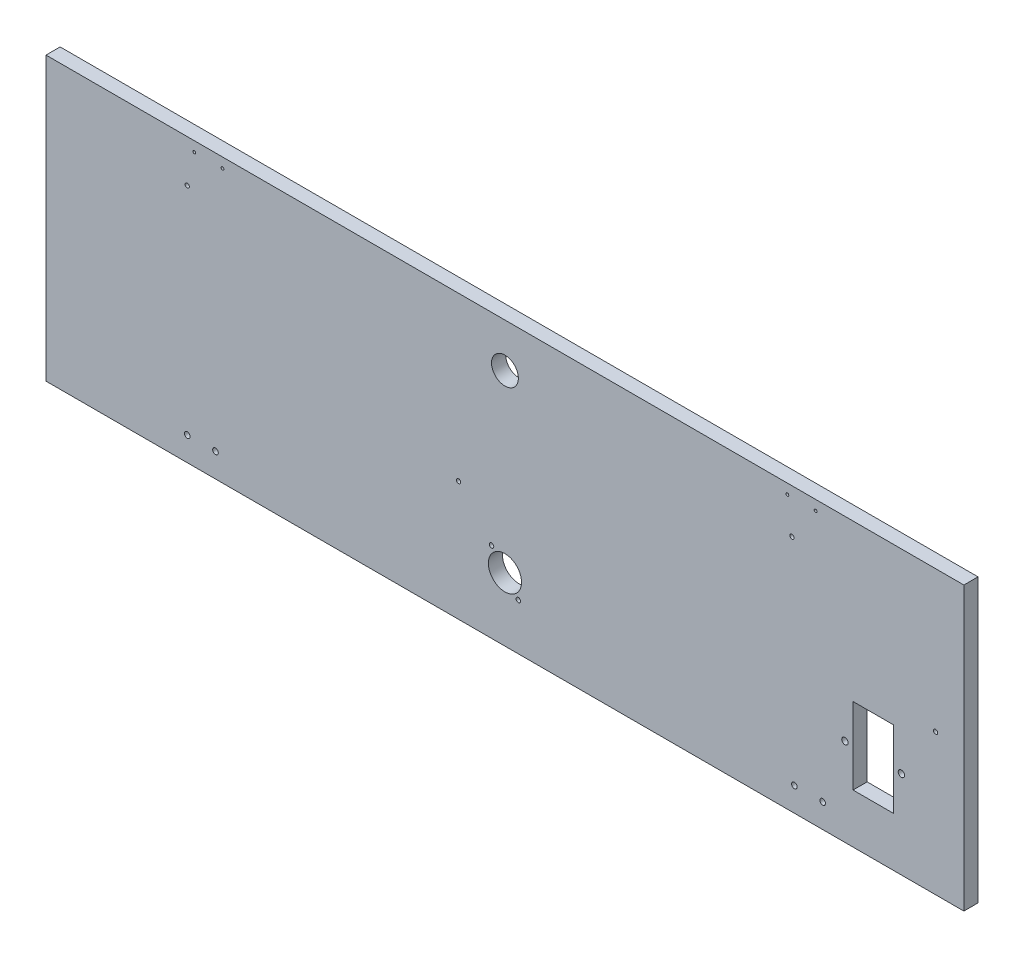
from build123d import *

# Parameters (mm, degrees)
ESQUISSE1_W             = 650
ESQUISSE1_H             = 200
BOSS_EXTRU_1_DEPTH      = 10
ESQUISSE2_R             = 2
ENL_V_MAT_EXTRU_1_DEPTH = 10
ESQUISSE3_R             = 1.6
ESQUISSE3_R_2           = 11.75
ESQUISSE3_W             = 28.5
ESQUISSE3_H             = 54.3
ESQUISSE3_R_3           = 2.25
ENL_V_MAT_EXTRU_2_DEPTH = 10
ESQUISSE4_R             = 9.5
ENL_V_MAT_EXTRU_3_DEPTH = 10
ESQUISSE5_R             = 1
ENL_V_MAT_EXTRU_4_DEPTH = 2
ESQUISSE6_R             = 1.5
ESQUISSE6_R_2           = 1
ENL_V_MAT_EXTRU_5_DEPTH = 10
ESQUISSE7_R             = 1.5
ENL_V_MAT_EXTRU_6_DEPTH = 10


with BuildPart() as part:
    # Esquisse1 → Boss.-Extru.1 (new body)
    with BuildSketch(Plane.XY):
        with Locations((325, 100)):
            Rectangle(ESQUISSE1_W, ESQUISSE1_H)
    extrude(amount=BOSS_EXTRU_1_DEPTH)

    # Esquisse2 → Enlèv. mat.-Extru.1 (cut)
    with BuildSketch(Plane.XY.offset(10)):
        with Locations((100, 17)):
            Circle(ESQUISSE2_R)
        with Locations((120, 17)):
            Circle(ESQUISSE2_R)
        with Locations((530, 17)):
            Circle(ESQUISSE2_R)
        with Locations((550, 17)):
            Circle(ESQUISSE2_R)
    extrude(amount=-ENL_V_MAT_EXTRU_1_DEPTH, mode=Mode.SUBTRACT)

    # Esquisse3 → Enlèv. mat.-Extru.2 (cut)
    with BuildSketch(Plane.XY.offset(10)):
        with Locations((315.499614794, 56.999404399)):
            Circle(ESQUISSE3_R)
        with Locations((325, 45)):
            Circle(ESQUISSE3_R_2)
        with Locations((334.500385206, 33.000595601)):
            Circle(ESQUISSE3_R)
        with Locations((585.75, 62.15)):
            Rectangle(ESQUISSE3_W, ESQUISSE3_H)
        with Locations((565.75, 62.15)):
            Circle(ESQUISSE3_R_3)
        with Locations((605.75, 62.15)):
            Circle(ESQUISSE3_R_3)
    extrude(amount=-ENL_V_MAT_EXTRU_2_DEPTH, mode=Mode.SUBTRACT)

    # Esquisse4 → Enlèv. mat.-Extru.3 (cut)
    with BuildSketch(Plane.XY.offset(10)):
        with Locations((325, 169)):
            Circle(ESQUISSE4_R)
    extrude(amount=-ENL_V_MAT_EXTRU_3_DEPTH, mode=Mode.SUBTRACT)

    # Esquisse5 → Enlèv. mat.-Extru.4 (cut)
    with BuildSketch(Plane.XY):
        with Locations((341, 169)):
            Circle(ESQUISSE5_R)
        with Locations((309, 169)):
            Circle(ESQUISSE5_R)
        with Locations((125, 193)):
            Circle(ESQUISSE5_R)
        with Locations((105, 193)):
            Circle(ESQUISSE5_R)
        with Locations((545, 193)):
            Circle(ESQUISSE5_R)
        with Locations((525, 193)):
            Circle(ESQUISSE5_R)
    extrude(amount=ENL_V_MAT_EXTRU_4_DEPTH, mode=Mode.SUBTRACT)

    # Esquisse6 → Enlèv. mat.-Extru.5 (cut)
    with BuildSketch(Plane(origin=(0, 0, 0), x_dir=(-1, 0, 0), z_dir=(0, 0, -1))):
        with Locations((-528.25, 168.75)):
            Circle(ESQUISSE6_R)
        with Locations((-630, 100)):
            Circle(ESQUISSE6_R)
        with Locations((-525, 193)):
            Circle(ESQUISSE6_R_2)
        with Locations((-545, 193)):
            Circle(ESQUISSE6_R_2)
        with Locations((-105, 193)):
            Circle(ESQUISSE6_R_2)
        with Locations((-125, 193)):
            Circle(ESQUISSE6_R_2)
    extrude(amount=-ENL_V_MAT_EXTRU_5_DEPTH, mode=Mode.SUBTRACT)

    # Esquisse7 → Enlèv. mat.-Extru.6 (cut)
    with BuildSketch(Plane(origin=(0, 0, 0), x_dir=(-1, 0, 0), z_dir=(0, 0, -1))):
        with Locations((-292.2, 84.75)):
            Circle(ESQUISSE7_R)
        with Locations((-100, 170)):
            Circle(ESQUISSE7_R)
    extrude(amount=-ENL_V_MAT_EXTRU_6_DEPTH, mode=Mode.SUBTRACT)


solid = part.part
